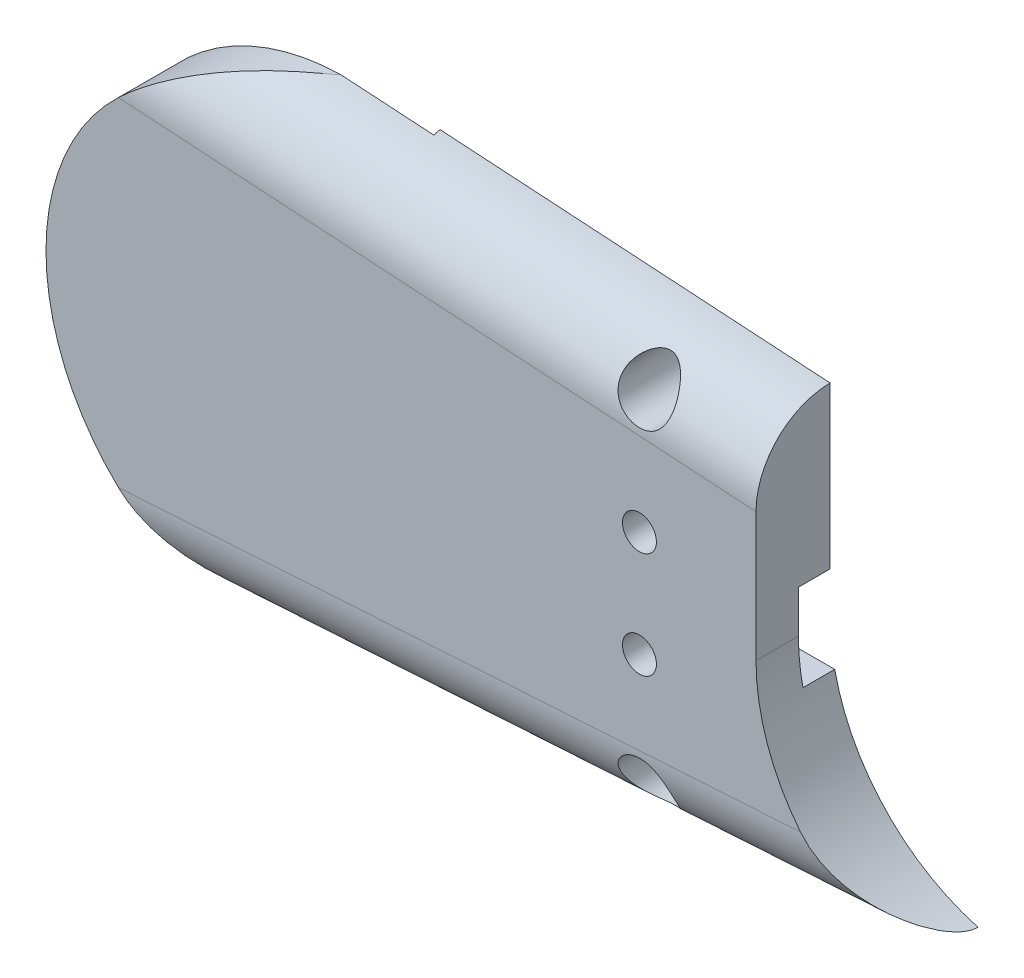
from build123d import *

# Parameters (mm, degrees)
BOSS_EXTRUDE1_DEPTH = 3.5
SKETCH8_R           = 11.5
JOINT_HOLE_DEPTH    = 0.35
JOINT_START         = 0.35
SKETCH3_R           = 7
JOINT_INSERT_DEPTH  = 3.25
FRICTION_START      = 0.35
SKETCH4_R           = 8
SKETCH4_R_2         = 7
FRICTION_DEPTH      = 0.25
CUT_EXTRUDE2_DEPTH  = 43
CUT_EXTRUDE3_DEPTH  = 11
SKETCH2_R           = 0.8
SCREW_HOLES_DEPTH   = 45.522466239
FILLET1_R           = 3.5
CUT_EXTRUDE4_START  = 3.5
SKETCH9_R           = 1.25
CUT_EXTRUDE4_DEPTH  = 3


with BuildPart() as part:
    # Sketch1 → Boss-Extrude1 (new body)
    with BuildSketch(Plane.XY):
        with BuildLine():
            ThreePointArc((-2.526427532, -9.157901721), (-7.558143342, -5.755386106), (-9.5, 0))
            Line((-9.5, 0), (-9.5, 9.59375))
            Line((-9.5, 9.59375), (-32, 11))
            ThreePointArc((-32, 11), (-43, 0), (-32, -11))
            Line((-32, -11), (-2.526427532, -9.157901721))
        make_face()
    extrude(amount=BOSS_EXTRUDE1_DEPTH)

    # Sketch8 → Joint Hole (cut)
    with BuildSketch(Plane.XY):
        with Locations((-32, 0)):
            Circle(SKETCH8_R)
        with BuildLine():
            Line((-20.5, -11.5), (-20.5, 0))
            ThreePointArc((-20.5, 0), (-23.868272016, -8.131727984), (-32, -11.5))
            Line((-32, -11.5), (-20.5, -11.5))
        make_face()
    extrude(amount=JOINT_HOLE_DEPTH, mode=Mode.SUBTRACT)

    # Sketch3 → Joint Insert (add)
    with BuildSketch(Plane.XY.offset(JOINT_START)):
        with Locations((-32, 0)):
            Circle(SKETCH3_R)
    extrude(amount=-JOINT_INSERT_DEPTH)

    # Sketch4 → Friction (add)
    with BuildSketch(Plane.XY.offset(FRICTION_START)):
        with Locations((-32, 0)):
            Circle(SKETCH4_R)
        with Locations((-32, 0)):
            Circle(SKETCH4_R_2, mode=Mode.SUBTRACT)
    extrude(amount=-FRICTION_DEPTH)

    # Sketch6 → Cut-Extrude2 (cut)
    with BuildSketch(Plane(origin=(0, 0, 0), x_dir=(0, 0, -1), z_dir=(1, 0, 0))):
        with BuildLine():
            Line((-1.5, 0), (-1.5, 2))
            Line((-1.5, 2), (0, 2))
            ThreePointArc((0, 2), (2, 0), (0, -2))
            Line((0, -2), (-1.5, -2))
            Line((-1.5, -2), (-1.5, 0))
        make_face()
    extrude(amount=-CUT_EXTRUDE2_DEPTH, mode=Mode.SUBTRACT)

    # Sketch7 → Cut-Extrude3 (cut)
    with BuildSketch(Plane(origin=(0, 0, 0), x_dir=(1, 0, 0), z_dir=(0, 1, 0))):
        with BuildLine():
            Line((-32, -1.5), (-30, -1.5))
            Line((-30, -1.5), (-30, 0))
            ThreePointArc((-30, 0), (-30.585786438, 1.414213562), (-32, 2))
            Line((-32, 2), (-43, 2))
            Line((-43, 2), (-43, -1.5))
            Line((-43, -1.5), (-32, -1.5))
        make_face()
    extrude(amount=-CUT_EXTRUDE3_DEPTH, mode=Mode.SUBTRACT)

    # Sketch2 → Screw Holes (cut, through all)
    with BuildSketch(Plane.XY):
        with Locations((-15, 8)):
            Circle(SKETCH2_R)
        with Locations((-15, -8)):
            Circle(SKETCH2_R)
        with Locations(Location((-15, 2.5, 0), (0, 0, 218.682187453))):
            Circle(SKETCH2_R)
        with Locations(Location((-15, -2.5, 0), (0, 0, 141.317812547))):
            Circle(SKETCH2_R)
    extrude(amount=SCREW_HOLES_DEPTH, mode=Mode.SUBTRACT)

    # Fillet1
    # the kernel refuses this fillet: 3.5 mm, written as the material it takes off along each edge
    with BuildSketch(Plane(origin=(-40.732960062, -11.545810004, 3.5), x_dir=(-0.062378286155180485, 0.9980525784828885, 0), z_dir=(0.9980525784828886, 0.06237828615518049, 0))) as fillet1_piece_1:
        with BuildLine():
            CenterArc((FILLET1_R, -FILLET1_R), FILLET1_R, 90, 90)
            Line((0, -FILLET1_R), (0, 0))
            Line((0, 0), (FILLET1_R, 0))
        make_face()
    extrude(amount=47.031081933, mode=Mode.SUBTRACT)
    with BuildSketch(Plane(origin=(-0.767039938, 9.047939996, 3.5), x_dir=(-0.06237828615518047, -0.9980525784828886, 0), z_dir=(-0.9980525784828886, 0.062378286155180464, 0))) as fillet1_piece_2:
        with BuildLine():
            CenterArc((FILLET1_R, -FILLET1_R), FILLET1_R, 90, 90)
            Line((0, -FILLET1_R), (0, 0))
            Line((0, 0), (FILLET1_R, 0))
        make_face()
    extrude(amount=40.043902481, mode=Mode.SUBTRACT)

    # Sketch9 → Cut-Extrude4 (cut)
    with BuildSketch(Plane.XY.offset(CUT_EXTRUDE4_START)):
        with Locations((-15, 8)):
            Circle(SKETCH9_R)
        with Locations((-15, -8)):
            Circle(SKETCH9_R)
    extrude(amount=-CUT_EXTRUDE4_DEPTH, mode=Mode.SUBTRACT)


solid = part.part
